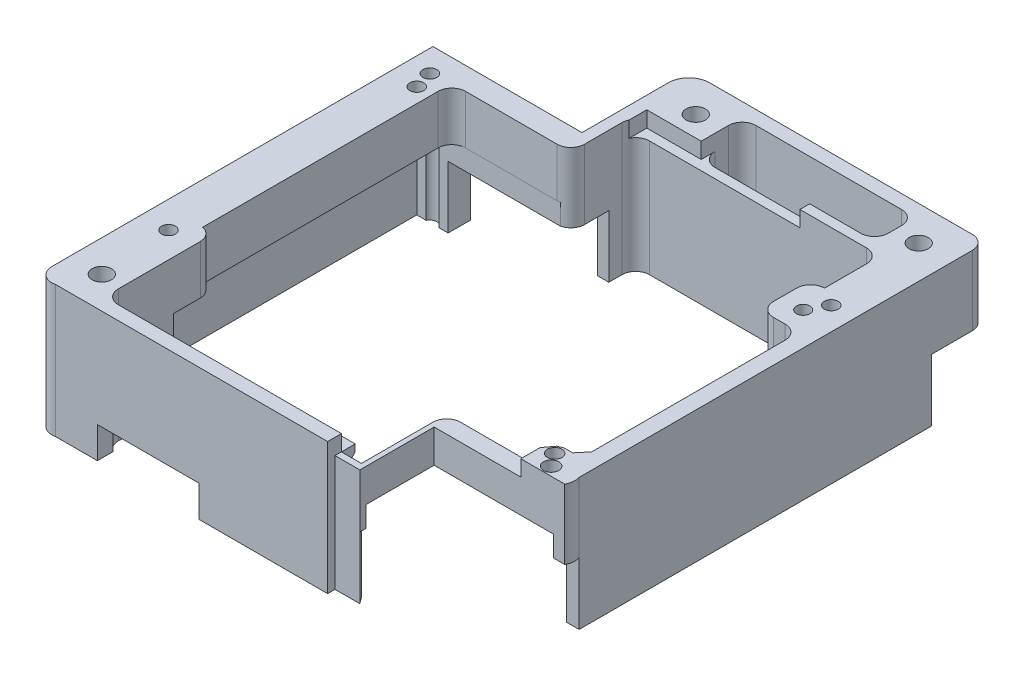
from build123d import *

# Parameters (mm, degrees)
BOSS_EXTRUDE1_DEPTH      = 3
BOSS_EXTRUDE1_DEPTH_BACK = 7.1
SKETCH1_R                = 1.4
SKETCH1_R_2              = 0.978558249
SKETCH1_R_3              = 1
SKETCH1_R_4              = 1.049573222
SKETCH1_R_5              = 1.1
SKETCH2_W                = 34.344615539
SKETCH2_H                = 2
BOSS_EXTRUDE2_DEPTH      = 10.1
BOSS_EXTRUDE5_START      = -2.3
SKETCH5_W                = 17.17230807
SKETCH5_H                = 2.00000017
BOSS_EXTRUDE5_DEPTH      = 1
CHAMFER2_SIZE            = 2
SKETCH7_W                = 25.118637785
SKETCH7_H                = 5.945254228
CUT_EXTRUDE1_DEPTH       = 21
SKETCH6_W                = 23.608360471
SKETCH6_H                = 2.652979876
CUT_EXTRUDE2_DEPTH       = 2.3
BOSS_EXTRUDE6_DEPTH      = 7.8
FILLET1_R                = 2
FILLET2_R                = 3
CUT_EXTRUDE3_DEPTH       = 3
SKETCH10_R               = 1.4
BOSS_EXTRUDE7_DEPTH      = 9
SKETCH11_W               = 14.76230902
SKETCH11_H               = 4.546864221
CUT_EXTRUDE4_DEPTH       = 10


with BuildPart() as part:
    # Sketch1 → Boss-Extrude1 (new, two sides: drawn at the far end of the back side and taken through both)
    with BuildSketch(Plane.XZ.offset(-0.1).offset(-BOSS_EXTRUDE1_DEPTH_BACK)):
        with BuildLine():
            Line((30.192257213, -35.75), (30.192257213, 21.25))
            ThreePointArc((30.192257213, 21.25), (30.283576859, 22.216024976), (29.993278542, 23.141913964))
            Line((29.993278542, 23.141913964), (23.620449619, 23.141913964))
            Line((23.620449619, 23.141913964), (23.620449619, 20.340022289))
            Line((23.620449619, 20.340022289), (24.655218734, 18.962582489))
            Line((24.655218734, 18.962582489), (25.4, 18.644711766))
            Line((25.4, 18.644711766), (26.644171144, 18.644711766))
            Line((26.644171144, 18.644711766), (27.9, 17.141397699))
            Line((27.9, 17.141397699), (27.9, -12.920142307))
            Line((27.9, -12.920142307), (22.198159173, -12.920142307))
            Line((22.198159173, -12.920142307), (22.198159173, -15.117708335))
            Line((22.198159173, -15.117708335), (-28.5, -15.117708335))
            Line((-28.5, -15.117708335), (-28.5, 17.141397699))
            Line((-28.5, 17.141397699), (-26.880698351, 17.141397699))
            Line((-26.880698351, 17.141397699), (-26.880698351, 26.25))
            Line((-26.880698351, 26.25), (-26.880698351, 34.985421621))
            Line((-26.880698351, 34.985421621), (-31.97343168, 34.985421621))
            ThreePointArc((-31.97343168, 34.985421621), (-33.729074299, 34.607448962), (-34.499899598, 32.985421621))
            Line((-34.499899598, 32.985421621), (-34.5, -22.239537014))
            Line((-34.5, -22.239537014), (-12.890012318, -22.239537014))
            Line((-12.890012318, -22.239537014), (-12.890012318, -37.75))
            Line((-12.890012318, -37.75), (28.19225721, -37.75))
            ThreePointArc((28.19225721, -37.75), (29.606470774, -37.164213563), (30.192257213, -35.75))
        make_face()
        with Locations(Location((25.4, -32.76626587, 0), (0, 0, 270))):
            Circle(SKETCH1_R, mode=Mode.SUBTRACT)
        with Locations(Location((-6.918752516, -32.76626587, 0), (0, 0, 270))):
            Circle(SKETCH1_R, mode=Mode.SUBTRACT)
        with Locations(Location((-29.911917882, 30.347920192, 0), (0, 0, 270))):
            Circle(SKETCH1_R, mode=Mode.SUBTRACT)
        with Locations(Location((25.4, -16.026111839, 0), (0, 0, 270))):
            Circle(SKETCH1_R_2, mode=Mode.SUBTRACT)
        with Locations(Location((-30.621441751, -16.026111839, 0), (0, 0, 270))):
            Circle(SKETCH1_R_3, mode=Mode.SUBTRACT)
        with Locations(Location((25.4, 20.014162826, 0), (0, 0, 270))):
            Circle(SKETCH1_R_4, mode=Mode.SUBTRACT)
        with Locations(Location((-30.621441751, 19.969466566, 0), (0, 0, 270))):
            Circle(SKETCH1_R_3, mode=Mode.SUBTRACT)
        with Locations(Location((26.849966888, -18.629931237, 0), (0, 0, 270))):
            Circle(SKETCH1_R_3, mode=Mode.SUBTRACT)
        with Locations(Location((-31.334123652, -18.629933616, 0), (0, 0, 270))):
            Circle(SKETCH1_R_3, mode=Mode.SUBTRACT)
        with Locations(Location((26.753545245, 21.870068845, 0), (0, 0, 270))):
            Circle(SKETCH1_R_5, mode=Mode.SUBTRACT)
    extrude(amount=BOSS_EXTRUDE1_DEPTH + BOSS_EXTRUDE1_DEPTH_BACK)

    # Sketch2 → Boss-Extrude2 (add)
    with BuildSketch(Plane.XZ.offset(2.9)):
        with Locations((-9.708390582, 33.985421621)):
            Rectangle(SKETCH2_W, SKETCH2_H)
    extrude(amount=-BOSS_EXTRUDE2_DEPTH)


with BuildPart() as boss_extrude5_tool:
    # Sketch5 → Boss-Extrude5 (new body)
    with BuildSketch(Plane(origin=(0, 7.2, 0), x_dir=(1, 0, 0), z_dir=(0, 1, 0)).offset(BOSS_EXTRUDE5_START)):
        with Locations((-1.122236547, -31.985419928)):
            Rectangle(SKETCH5_W, SKETCH5_H)
    extrude(amount=-BOSS_EXTRUDE5_DEPTH)


with BuildPart() as part_1:
    add(part.part)


with BuildPart() as part_2:
    # Boss-Extrude5: joined with boss_extrude5_tool
    add(part_1.part.fuse(boss_extrude5_tool.part, tol=0.00001))

    # Chamfer2
    chamfer2_edges = [part_2.edges().sort_by_distance(p)[0] for p in [
        (-1.122236547, 3.9, 32.985420013),
    ]]
    chamfer(chamfer2_edges, length=CHAMFER2_SIZE)

    # Sketch7 → Cut-Extrude1 (cut)
    with BuildSketch(Plane.XZ.offset(2.9)):
        Polygon((22.198159173, -15.117708335), (22.198159173, -20.290203117), (24.221980839, -20.290203117), (24.221980839, -28.38841979), (-11.248708011, -28.38841979), (-11.248708011, -18.978432706), (-28.5, -18.978432706), (-28.5, -15.117708335), align=None)
        with Locations((9.391518078, -32.777372884)):
            Rectangle(SKETCH7_W, SKETCH7_H)
    extrude(amount=-CUT_EXTRUDE1_DEPTH, mode=Mode.SUBTRACT)

    # Sketch6 → Cut-Extrude2 (cut)
    with BuildSketch(Plane(origin=(0, 7.2, 0), x_dir=(1, 0, 0), z_dir=(0, 1, 0))):
        with Locations((0.749418639, 28.478255832)):
            Rectangle(SKETCH6_W, SKETCH6_H)
    extrude(amount=-CUT_EXTRUDE2_DEPTH, mode=Mode.SUBTRACT)

    # Sketch8 → Boss-Extrude6 (add)
    with BuildSketch(Plane.XZ.offset(2.9)):
        Polygon((23.620449619, 23.141913964), (11.06088169, 23.141913964), (11.06088169, 33.914151599), (7.463917188, 33.914151599), (7.463917188, 32.985421621), (10.362205773, 32.985421621), (10.362205773, 20.625646), (23.620449619, 20.625646), align=None)
    extrude(amount=-BOSS_EXTRUDE6_DEPTH)

    # Fillet1
    # the kernel refuses this fillet: 2 mm, written as the material it adds along each edge
    with BuildSketch(Plane(origin=(-28.5, -2.9, -18.978432706), x_dir=(1, 0, 0), z_dir=(0, 1, 0)), Plane(origin=(21.95083697, -2.9, -29.80474577), x_dir=(-1, 0, 0), z_dir=(0, 1, 0)), Plane(origin=(-3.167800815, -2.9, -35.749999998), x_dir=(1, 0, 0), z_dir=(0, 1, 0)), Plane(origin=(21.95083697, -2.9, -35.749999998), x_dir=(0, 0, 1), z_dir=(0, 1, 0)), Plane(origin=(24.221980839, -2.9, -28.38841979), x_dir=(0, 0, 1), z_dir=(0, 1, 0))) as fillet1_piece_1:
        with BuildLine():
            CenterArc((FILLET1_R, -FILLET1_R), FILLET1_R, 90, 90)
            Line((0, -FILLET1_R), (0, 0))
            Line((0, 0), (FILLET1_R, 0))
        make_face()
    extrude(amount=10.1)
    with BuildSketch(Plane(origin=(-3.167800815, -2.9, -29.80474577), x_dir=(1, 0, 0), z_dir=(0, 1, 0))) as fillet1_piece_2:
        with BuildLine():
            CenterArc((FILLET1_R, FILLET1_R), FILLET1_R, 180, 90)
            Line((0, FILLET1_R), (0, 0))
            Line((0, 0), (FILLET1_R, 0))
        make_face()
    extrude(amount=7.8)
    with BuildSketch(Plane(origin=(-11.248708011, -2.9, -28.38841979), x_dir=(1, 0, 0), z_dir=(0, 1, 0))) as fillet1_piece_3_section:
        with BuildLine():
            CenterArc((FILLET1_R, -FILLET1_R), FILLET1_R, 90, 90)
            Line((0, -FILLET1_R), (0, 0))
            Line((0, 0), (FILLET1_R, 0))
        make_face()
    fillet1_piece_3 = extrude(amount=15.1, mode=Mode.PRIVATE)
    fillet1_piece_3 = split(fillet1_piece_3, bisect_by=Plane(origin=(-11.248708011, 4.9, -28.38841979), z_dir=(0, -1, 0)), keep=Keep.TOP, mode=Mode.PRIVATE)
    add(fillet1_piece_3)
    with BuildSketch(Plane(origin=(-11.248708011, -2.9, -28.38841979), x_dir=(1, 0, 0), z_dir=(0, 1, 0))) as fillet1_piece_4_section:
        with BuildLine():
            CenterArc((FILLET1_R, -FILLET1_R), FILLET1_R, 90, 90)
            Line((0, -FILLET1_R), (0, 0))
            Line((0, 0), (FILLET1_R, 0))
        make_face()
    fillet1_piece_4 = extrude(amount=10.1, mode=Mode.PRIVATE)
    fillet1_piece_4 = split(fillet1_piece_4, bisect_by=Plane(origin=(-11.054761596, -2.9, -28.38841979), z_dir=(-1, 0, 0)), keep=Keep.TOP, mode=Mode.PRIVATE)
    add(fillet1_piece_4)
    with BuildSketch(Plane(origin=(-26.880698351, -2.9, 32.985421621), x_dir=(1, 0, 0), z_dir=(0, 1, 0)), Plane(origin=(27.9, 7.2, -12.920142307), x_dir=(0, 0, 1), z_dir=(0, -1, 0))) as fillet1_piece_5:
        with BuildLine():
            CenterArc((FILLET1_R, FILLET1_R), FILLET1_R, 180, 90)
            Line((0, FILLET1_R), (0, 0))
            Line((0, 0), (FILLET1_R, 0))
        make_face()
    extrude(amount=10.1)
    # the kernel refuses this fillet: 2 mm, written as the material it takes off along each edge
    with BuildSketch(Plane(origin=(22.198159173, -7.9, -20.290203117), x_dir=(0, 0, 1), z_dir=(0, 1, 0)), Plane(origin=(-11.248708011, -7.9, -18.978432706), x_dir=(0, 0, -1), z_dir=(0, 1, 0))) as fillet1_2_piece_1:
        with BuildLine():
            CenterArc((FILLET1_R, FILLET1_R), FILLET1_R, 180, 90)
            Line((0, FILLET1_R), (0, 0))
            Line((0, 0), (FILLET1_R, 0))
        make_face()
    extrude(amount=20.1, mode=Mode.SUBTRACT)
    with BuildSketch(Plane(origin=(-26.880698351, 12.108582258, 17.141397699), x_dir=(-1, 0, 0), z_dir=(0, -1, 0))) as fillet1_2_piece_2:
        with BuildLine():
            CenterArc((2, -1.963432903), FILLET1_R, 100.973162392, 79.026837608)
            Line((0, -1.963432903), (0, 0))
            Line((0, 0), (1.619301649, 0))
        make_face()
    extrude(amount=19.917164516, mode=Mode.SUBTRACT)
    with BuildSketch(Plane(origin=(10.362205773, -7.9, 20.625646), x_dir=(1, 0, 0), z_dir=(0, 1, 0))) as fillet1_2_piece_3:
        with BuildLine():
            CenterArc((FILLET1_R, -FILLET1_R), FILLET1_R, 90, 90)
            Line((0, -FILLET1_R), (0, 0))
            Line((0, 0), (FILLET1_R, 0))
        make_face()
    extrude(amount=17.8, mode=Mode.SUBTRACT)
    with BuildSketch(Plane(origin=(22.198159173, 12.2, -12.920142307), x_dir=(1, 0, 0), z_dir=(0, -1, 0))) as fillet1_2_piece_4:
        with BuildLine():
            CenterArc((FILLET1_R, -FILLET1_R), FILLET1_R, 90, 90)
            Line((0, -FILLET1_R), (0, 0))
            Line((0, 0), (FILLET1_R, 0))
        make_face()
    extrude(amount=20.1, mode=Mode.SUBTRACT)

    # Fillet2
    fillet2_edges = [part_2.edges().sort_by_distance(p)[0] for p in [
        (-12.890012318, 2.15, -37.75),
    ]]
    fillet(fillet2_edges, radius=FILLET2_R)

    # Sketch9 → Cut-Extrude3 (cut)
    with BuildSketch(Plane.XZ.offset(2.9)):
        Polygon((-33.621441751, 22.973888161), (9.891803023, 22.973888161), (9.891803023, 32.985421621), (28.378558249, 32.985421621), (28.378558249, 22.973888161), (28.378558249, -19.026111839), (-33.621441751, -19.026111839), align=None)
    extrude(amount=-CUT_EXTRUDE3_DEPTH, mode=Mode.SUBTRACT)

    # Sketch10 → Boss-Extrude7 (add)
    # profile 1 of 2: a face of its own
    with BuildSketch(Plane.XZ.offset(2.9)):
        with BuildLine():
            Line((30.192257213, -29.80474577), (-12.890012318, -29.80474577))
            Line((-12.890012318, -29.80474577), (-12.890012318, -24.488656194))
            Line((-12.890012318, -24.488656194), (-11.248708011, -24.488656194))
            Line((-11.248708011, -24.488656194), (-11.248708011, -26.38841979))
            ThreePointArc((-11.248708011, -26.38841979), (-10.662921573, -27.802633352), (-9.248708011, -28.38841979))
            Line((-9.248708011, -28.38841979), (22.221980839, -28.38841979))
            ThreePointArc((22.221980839, -28.38841979), (23.636194402, -27.802633352), (24.221980839, -26.38841979))
            Line((24.221980839, -26.38841979), (24.221980839, -20.290203117))
            Line((24.221980839, -20.290203117), (28.378558249, -20.290203117))
            Line((28.378558249, -20.290203117), (28.378558249, 21.25))
            Line((28.378558249, 21.25), (30.192257213, 21.25))
            Line((30.192257213, 21.25), (30.192257213, -29.80474577))
        make_face()
        with Locations(Location((27.403137641, -26.38841979, 0), (0, 0, 270))):
            Circle(SKETCH10_R, mode=Mode.SUBTRACT)
    # profile 2 of 2: a face of its own
    with BuildSketch(Plane.XZ.offset(2.9)):
        with BuildLine():
            Line((-34.5, -22.239537014), (-34.499899598, 32.985421621))
            ThreePointArc((-34.499899598, 32.985421621), (-33.729074299, 34.607448962), (-31.97343168, 34.985421621))
            Line((-31.97343168, 34.985421621), (7.463917188, 34.985421621))
            Line((7.463917188, 34.985421621), (7.463917188, 33.914151599))
            Line((7.463917188, 33.914151599), (11.06088169, 33.914151599))
            Line((11.06088169, 33.914151599), (10.362205773, 32.985421621))
            Line((10.362205773, 32.985421621), (-24.880698351, 32.985421621))
            ThreePointArc((-24.880698351, 32.985421621), (-26.294911914, 32.399635183), (-26.880698351, 30.985421621))
            Line((-26.880698351, 30.985421621), (-26.880698351, 28.624768728))
            Line((-26.880698351, 28.624768728), (-33.621441751, 28.624768728))
            Line((-33.621441751, 28.624768728), (-33.621441751, -19.026111839))
            Line((-33.621441751, -19.026111839), (-32.252297283, -19.026111839))
            ThreePointArc((-32.252297283, -19.026111839), (-31.334123652, -19.629933616), (-30.415950022, -19.026111839))
            Line((-30.415950022, -19.026111839), (-29.077300846, -19.026111839))
            Line((-29.077300846, -19.026111839), (-29.077300846, -22.239537014))
            Line((-29.077300846, -22.239537014), (-34.5, -22.239537014))
        make_face()
        with Locations(Location((-29.911917882, 30.347920192, 0), (0, 0, 270))):
            Circle(SKETCH10_R, mode=Mode.SUBTRACT)
    extrude(amount=BOSS_EXTRUDE7_DEPTH)

    # Sketch11 → Cut-Extrude4 (cut)
    with BuildSketch(Plane.XY.offset(34.985421621)):
        with Locations((-18.538340522, -9.62656789)):
            Rectangle(SKETCH11_W, SKETCH11_H)
    extrude(amount=-CUT_EXTRUDE4_DEPTH, mode=Mode.SUBTRACT)


solid = part_2.part
